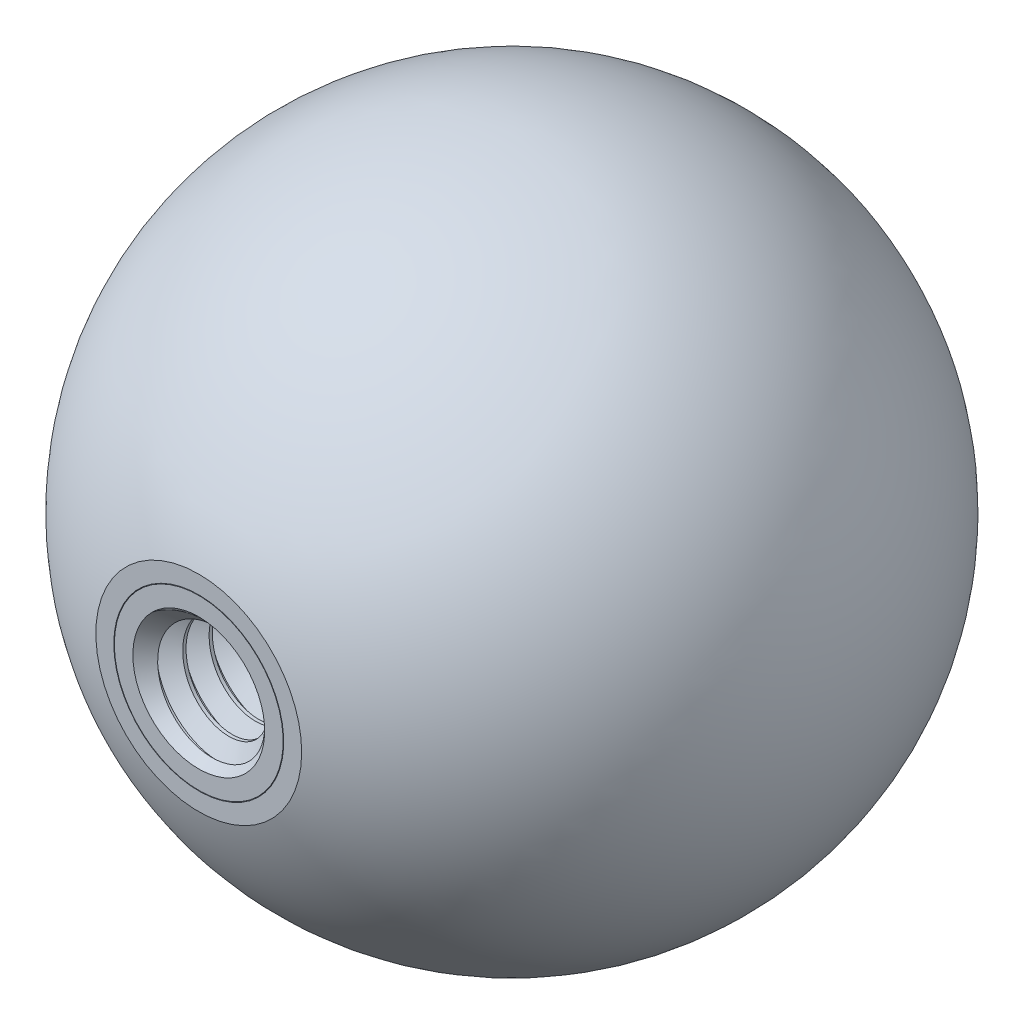
from build123d import *

# Parameters (mm, degrees)
SKETCH6_R               = 4.091383581
SKETCH6_R_2             = 4.065983581
CUT_EXTRUDE_THIN1_DEPTH = 12.7
SKETCH7_R               = 3.175
BOSS_EXTRUDE1_DEPTH     = 12.7
BOSS_EXTRUDE2_START     = -12.7
SKETCH8_R               = 3.175
BOSS_EXTRUDE2_DEPTH     = 12.7
CUT_SWEEP1_PITCH        = 1.27
SKETCH5_R               = 3.175
CUT_EXTRUDE1_DEPTH      = 39.240301569


with BuildPart() as part:
    # Sketch2 → Revolve1 (revolve)
    with BuildSketch(Plane(origin=(0, 0, 0), x_dir=(0, 0, -1), z_dir=(1, 0, 0)), mode=Mode.PRIVATE) as revolve1_sk:
        with BuildLine():
            Line((-2.38125, 3.175), (-2.38125, 0))
            Line((-2.38125, 0), (15.875, 0))
            ThreePointArc((15.875, 0), (2.510057893, 15.675306516), (-15.08125, 4.956967161))
            Line((-15.08125, 4.956967161), (-15.08125, 3.175))
            Line((-15.08125, 3.175), (-2.38125, 3.175))
        make_face()
    revolve(revolve1_sk.sketch.rotate(Axis((0, 0, 15.875), (0, 0, -1)), 90), axis=Axis((0, 0, 15.875), (0, 0, -1)))

    # Sketch6 → Cut-Extrude-Thin1 (cut)
    with BuildSketch(Plane(origin=(0, 0, 15.08125), x_dir=(-1, 0, 0), z_dir=(0, 0, -1))):
        Circle(SKETCH6_R)
        Circle(SKETCH6_R_2, mode=Mode.SUBTRACT)
    extrude(amount=CUT_EXTRUDE_THIN1_DEPTH, mode=Mode.SUBTRACT)

    # Sketch8 → Boss-Extrude2 (add)
    with BuildSketch(Plane.XY.offset(15.08125).offset(BOSS_EXTRUDE2_START)):
        Circle(SKETCH8_R)
    extrude(amount=BOSS_EXTRUDE2_DEPTH)


with BuildPart() as body_2:
    # Sketch7 → Boss-Extrude1 (new body)
    with BuildSketch(Plane.XY.offset(15.08125)):
        Circle(SKETCH7_R)
    extrude(amount=-BOSS_EXTRUDE1_DEPTH)

    # Cut-Sweep1: the profile of Sketch4 profile screwed along a right-hand helix of 11 turns, 8 arcs to a turn; built about Z, then put on its axis
    cut_sweep1_z = Axis((0, 0, 0), (0, 0, 1))
    cut_sweep1_corners = [(3.1753, 0, -1.111423205), (3.1753, 0, 0.000173205), (2.350110803, 0, -0.47625), (2.350110803, 0, -0.635)]
    with BuildLine(mode=Mode.PRIVATE) as cut_sweep1_profile:
        Line(cut_sweep1_corners[0], cut_sweep1_corners[1])
        Line(cut_sweep1_corners[1], cut_sweep1_corners[2])
        Line(cut_sweep1_corners[2], cut_sweep1_corners[3])
        Line(cut_sweep1_corners[3], cut_sweep1_corners[0])
    cut_sweep1_cap = Face(cut_sweep1_profile.wire())
    cut_sweep1_turn_angles = [0, 22.5, 45, 67.5, 90, 112.5, 135, 157.5, 180, 202.5, 225, 247.5, 270, 292.5, 315, 337.5, 360]
    cut_sweep1_turn_weights = [1, 0.9238795325112867, 1, 0.9238795325112867, 1, 0.9238795325112867, 1, 0.9238795325112867, 1, 0.9238795325112867, 1, 0.9238795325112867, 1, 0.9238795325112867, 1, 0.9238795325112867, 1]
    cut_sweep1_turn_rails = [Edge.make_bspline([Vector(p[0], p[1], 0).rotate(cut_sweep1_z, cut_sweep1_turn_angles[k]) / cut_sweep1_turn_weights[k] + Vector(0, 0, p[2] + CUT_SWEEP1_PITCH * cut_sweep1_turn_angles[k] / 360) for k in range(17)], [0, 0, 0, 1, 1, 2, 2, 3, 3, 4, 4, 5, 5, 6, 6, 7, 7, 8, 8, 8], 2, cut_sweep1_turn_weights) for p in cut_sweep1_corners]
    cut_sweep1_turn_sides = [Face.make_surface_from_curves(cut_sweep1_turn_rails[p[0]], cut_sweep1_turn_rails[p[1]]) for p in [(0, 1), (1, 2), (2, 3), (3, 0)]]
    cut_sweep1 = Plane(origin=(0, 0, 15.08125), x_dir=(0, 1, 0), z_dir=(0, 0, -1)) * Solid(Shell([*[p.moved(Location((0, 0, CUT_SWEEP1_PITCH * i))) for i in range(11) for p in cut_sweep1_turn_sides], cut_sweep1_cap, cut_sweep1_cap.rotate(cut_sweep1_z, 3960).moved(Location((0, 0, CUT_SWEEP1_PITCH * 3960 / 360)))]))
    add(cut_sweep1, mode=Mode.SUBTRACT)


with BuildPart() as part_1:
    add(part.part)

    # Combine1: cut body 2
    add(body_2.part, mode=Mode.SUBTRACT)

    # Sketch5 → Cut-Extrude1 (cut)
    with BuildSketch(Plane.XY.offset(15.08125)):
        Circle(SKETCH5_R)
    extrude(amount=CUT_EXTRUDE1_DEPTH, mode=Mode.SUBTRACT)

    # Cut-Extrude1 cone 1 section (through the dimple's axis) → Cut-Extrude1 other way (revolve, cut)
    with BuildSketch(Plane(origin=(0, 0, 15.08125), x_dir=(0, -1, 0), z_dir=(1, 0, 0))):
        Polygon((0, 0), (3.175, 0), (0, 3.175), align=None)
    revolve(axis=Axis((0, 0, 15.08125), (0, 0, -1)), mode=Mode.SUBTRACT)


solid = part_1.part
